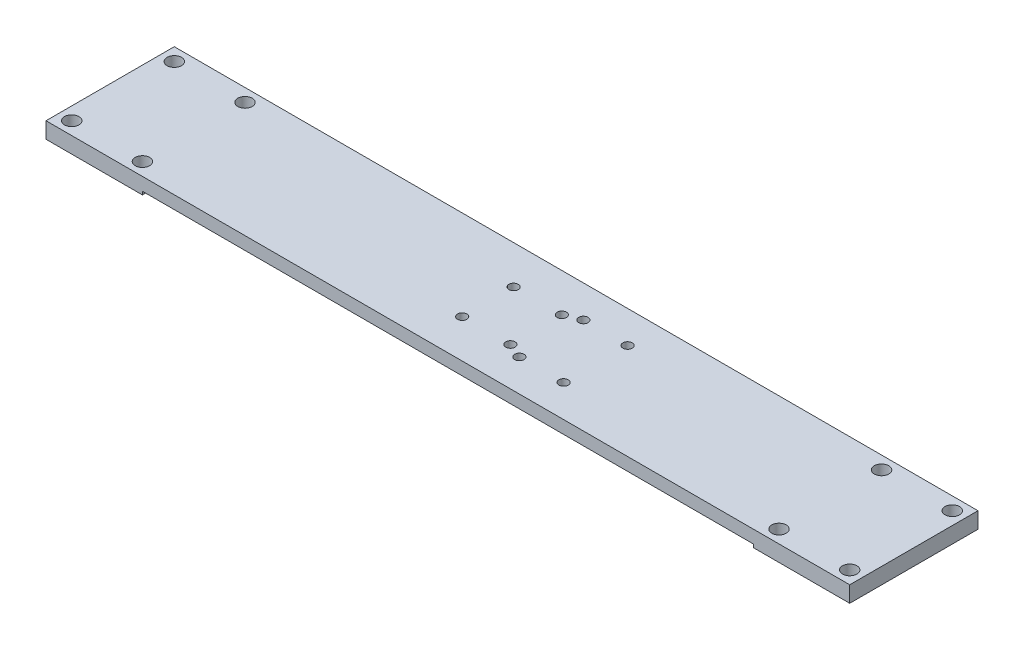
from build123d import *

# Parameters (mm, degrees)
SKETCH_1_W          = 250
SKETCH_1_H          = 39.9
EXTRUDE_1_DEPTH     = 4
SKETCH_2_R          = 1.45
CUT_EXTRUDE_1_DEPTH = 12
SKETCH_3_R          = 1.45
CUT_EXTRUDE_2_DEPTH = 12
SKETCH_7_R          = 2.25
CUT_EXTRUDE_6_DEPTH = 20
SKETCH_8_W          = 30
SKETCH_8_H          = 39.9
SKETCH_8_R          = 2.25
EXTRUDE_2_DEPTH     = 1


with BuildPart() as part:
    # 草图1 → 凸台-拉伸1 (new body)
    with BuildSketch(Plane(origin=(0, 0, 0), x_dir=(1, 0, 0), z_dir=(0, 1, 0))):
        with Locations((-125, 19.95)):
            Rectangle(SKETCH_1_W, SKETCH_1_H)
    extrude(amount=EXTRUDE_1_DEPTH)

    # 草图2 → 切除-拉伸1 (cut)
    with BuildSketch(Plane(origin=(0, 4, 0), x_dir=(1, 0, 0), z_dir=(0, 1, 0))):
        with Locations((-132.5, 27.95)):
            Circle(SKETCH_2_R)
        with Locations((-117.5, 27.95)):
            Circle(SKETCH_2_R)
        with Locations((-117.5, 11.95)):
            Circle(SKETCH_2_R)
        with Locations((-132.5, 11.95)):
            Circle(SKETCH_2_R)
    extrude(amount=-CUT_EXTRUDE_1_DEPTH, mode=Mode.SUBTRACT)

    # 草图3 → 切除-拉伸2 (cut)
    with BuildSketch(Plane(origin=(-275.091791604, 0, 105.376222054), x_dir=(-0.9999983055135633, 0, 0.0018409155336922224), z_dir=(0, -1, 0))):
        with Locations((-162.553914397, 115.077169025)):
            Circle(SKETCH_3_R)
        with Locations((-162.590548616, 134.977135305)):
            Circle(SKETCH_3_R)
        with Locations((-176.303891098, 115.051856436)):
            Circle(SKETCH_3_R)
        with Locations((-176.340525317, 134.951822716)):
            Circle(SKETCH_3_R)
    extrude(amount=-CUT_EXTRUDE_2_DEPTH, mode=Mode.SUBTRACT)

    # 草图7 → 切除-拉伸6 (cut)
    with BuildSketch(Plane(origin=(0, 4, 0), x_dir=(1, 0, 0), z_dir=(0, 1, 0))):
        with Locations((-246, 35.9)):
            Circle(SKETCH_7_R)
        with Locations((-224, 35.9)):
            Circle(SKETCH_7_R)
        with Locations((-224, 4)):
            Circle(SKETCH_7_R)
        with Locations((-246, 4)):
            Circle(SKETCH_7_R)
        with Locations((-4, 4)):
            Circle(SKETCH_7_R)
        with Locations((-26, 4)):
            Circle(SKETCH_7_R)
        with Locations((-26, 35.9)):
            Circle(SKETCH_7_R)
        with Locations((-4, 35.9)):
            Circle(SKETCH_7_R)
    extrude(amount=-CUT_EXTRUDE_6_DEPTH, mode=Mode.SUBTRACT)

    # 草图8 → 凸台-拉伸2 (add)
    # profile 1 of 2: a face of its own
    with BuildSketch(Plane.XZ):
        with Locations((-235, -19.95)):
            Rectangle(SKETCH_8_W, SKETCH_8_H)
        with Locations((-224, -35.9)):
            Circle(SKETCH_8_R, mode=Mode.SUBTRACT)
        with Locations((-246, -35.9)):
            Circle(SKETCH_8_R, mode=Mode.SUBTRACT)
        with Locations((-224, -4)):
            Circle(SKETCH_8_R, mode=Mode.SUBTRACT)
        with Locations((-246, -4)):
            Circle(SKETCH_8_R, mode=Mode.SUBTRACT)
    # profile 2 of 2: a face of its own
    with BuildSketch(Plane.XZ):
        with Locations((-15, -19.95)):
            Rectangle(SKETCH_8_W, SKETCH_8_H)
        with Locations((-4, -35.9)):
            Circle(SKETCH_8_R, mode=Mode.SUBTRACT)
        with Locations((-26, -35.9)):
            Circle(SKETCH_8_R, mode=Mode.SUBTRACT)
        with Locations((-4, -4)):
            Circle(SKETCH_8_R, mode=Mode.SUBTRACT)
        with Locations((-26, -4)):
            Circle(SKETCH_8_R, mode=Mode.SUBTRACT)
    extrude(amount=EXTRUDE_2_DEPTH)


solid = part.part
